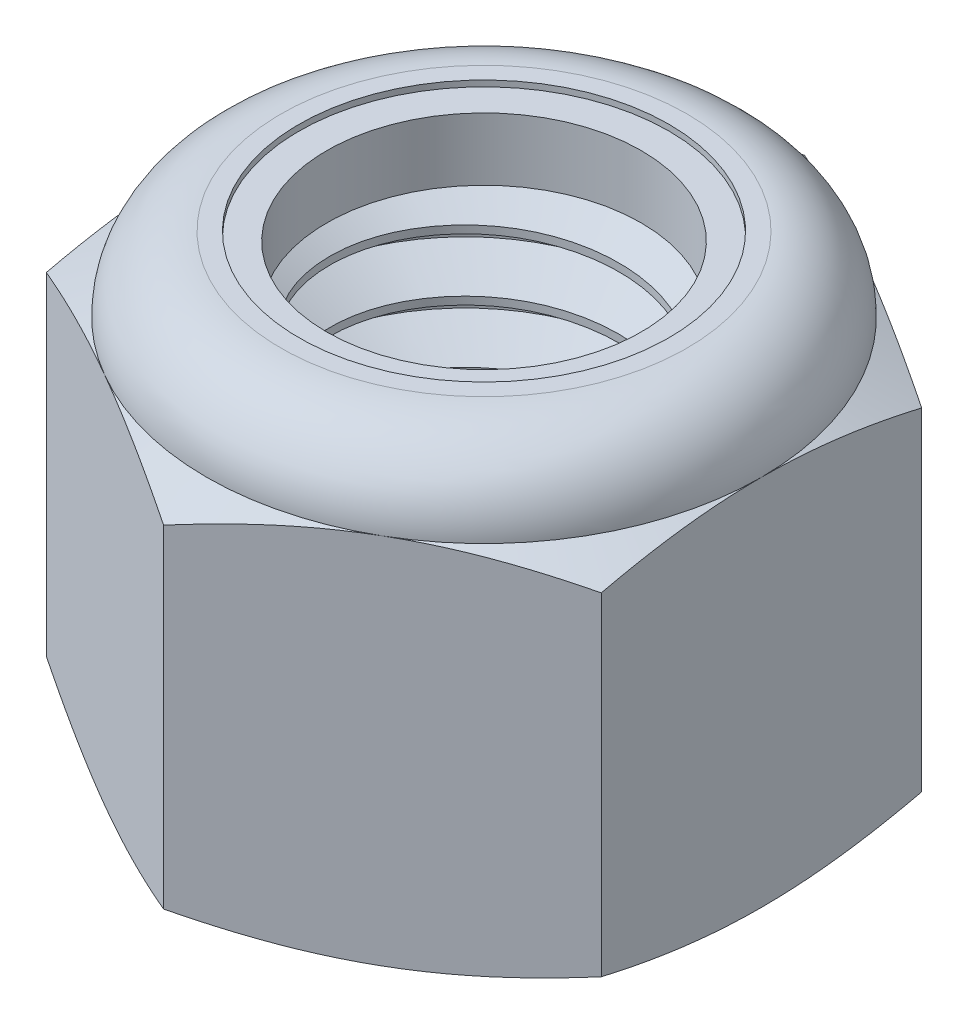
from build123d import *

# Parameters (mm, degrees)
SKETCH13_R       = 4.7625
EXTRUDE1_DEPTH   = 11.509375
SKETCH2_W        = 4.7625
SKETCH2_H        = 9.591145833
CUT_SWEEP1_PITCH = 1.5875
SKETCH12_W       = 5.23875
SKETCH12_H       = 9.591145833


with BuildPart() as part:
    # Sketch13 → Extrude1 (new body)
    with BuildSketch(Plane(origin=(0, 0, 0), x_dir=(1, 0, 0), z_dir=(0, 1, 0))):
        Polygon((0, 8.248891971), (-7.14375, 4.124445986), (-7.14375, -4.124445986), (0, -8.248891971), (7.14375, -4.124445986), (7.14375, 4.124445986), align=None)
        with Locations(Location((0, 0, 0), (0, 0, 90))):
            Circle(SKETCH13_R, mode=Mode.SUBTRACT)
    extrude(amount=EXTRUDE1_DEPTH)

    # Sketch5 → Cut-Revolve3 (revolve, cut)
    with BuildSketch(Plane(origin=(0, 0, 0), x_dir=(0, 0, -1), z_dir=(1, 0, 0))):
        with BuildLine():
            Line((0, 0), (7.14375, 0))
            Line((7.14375, 0), (8.248891971, 0.515336164))
            Line((8.248891971, 0.515336164), (8.248891971, 9.075809669))
            Line((8.248891971, 9.075809669), (7.14375, 9.591145833))
            ThreePointArc((7.14375, 9.591145833), (6.581913685, 10.947538685), (5.225520833, 11.509375))
            Line((5.225520833, 11.509375), (5.225520833, 12.779375))
            Line((5.225520833, 12.779375), (9.518891971, 12.779375))
            Line((9.518891971, 12.779375), (9.518891971, -1.27))
            Line((9.518891971, -1.27), (0, -1.27))
            Line((0, -1.27), (0, 0))
        make_face()
    revolve(axis=Axis((0, 0, 0), (0, 1, 0)), mode=Mode.SUBTRACT)

    # Sketch6 → Cut-Revolve4 (revolve, cut)
    with BuildSketch(Plane(origin=(0, 0, 0), x_dir=(0, 0, -1), z_dir=(1, 0, 0))):
        with BuildLine():
            Line((0, 9.591145833), (6.99135, 9.591145833))
            ThreePointArc((6.99135, 9.591145833), (6.474150612, 10.839775612), (5.225520833, 11.356975))
            Line((5.225520833, 11.356975), (2.612760417, 11.356975))
            Line((2.612760417, 11.356975), (2.612760417, 12.779375))
            Line((2.612760417, 12.779375), (0, 12.779375))
            Line((0, 12.779375), (0, 9.591145833))
        make_face()
    revolve(axis=Axis((0, 12.779375, 0), (0, -1, 0)), mode=Mode.SUBTRACT)

    # Sketch4 → Cut-Revolve2 (revolve, cut)
    with BuildSketch(Plane(origin=(0, 0, 0), x_dir=(0, 0, -1), z_dir=(1, 0, 0))):
        Polygon((0, 9.591145833), (5.23875, 9.591145833), (0, 7.148276589), align=None)
        Polygon((0, 2.442869244), (5.23875, 0), (0, 0), align=None)
    revolve(axis=Axis((0, 0, 0), (0, 1, 0)), mode=Mode.SUBTRACT)

    # Sketch12 → Revolve4 (revolve)
    with BuildSketch(Plane(origin=(0, 0, 0), x_dir=(0, 0, -1), z_dir=(1, 0, 0)), mode=Mode.PRIVATE) as revolve4_sk:
        with Locations((2.619375, 4.795572917)):
            Rectangle(SKETCH12_W, SKETCH12_H)
    revolve(revolve4_sk.sketch.rotate(Axis((0, 0, 0), (0, 1, 0)), 180), axis=Axis((0, 0, 0), (0, 1, 0)))


with BuildPart() as body_2:
    # Sketch7 → Revolve2 (revolve)
    with BuildSketch(Plane(origin=(0, 0, 0), x_dir=(0, 0, -1), z_dir=(1, 0, 0))):
        with BuildLine():
            Line((4.048125, 9.667345833), (6.913430867, 9.667345833))
            ThreePointArc((6.913430867, 9.667345833), (6.39301751, 10.812537757), (5.225520833, 11.280775))
            Line((5.225520833, 11.280775), (4.048125, 11.280775))
            Line((4.048125, 11.280775), (4.048125, 9.667345833))
        make_face()
    revolve(axis=Axis((0, 9.667345833, 0), (0, 1, 0)))


with BuildPart() as body_3:
    # Sketch2 → Revolve1 (revolve)
    with BuildSketch(Plane(origin=(0, 0, 0), x_dir=(0, 0, -1), z_dir=(1, 0, 0)), mode=Mode.PRIVATE) as revolve1_sk:
        with Locations((2.38125, 4.795572917)):
            Rectangle(SKETCH2_W, SKETCH2_H)
    revolve(revolve1_sk.sketch.rotate(Axis((0, -4.7625, 0), (0, 1, 0)), 180), axis=Axis((0, -4.7625, 0), (0, 1, 0)))

    # Cut-Sweep1: the profile of Sketch9 screwed along a right-hand helix of 8.25 turns, 8 arcs to a turn; built about Z, then put on its axis
    cut_sweep1_z = Axis((0, 0, 0), (0, 0, 1))
    cut_sweep1_corners = [(4.934351916, 0, 0.09921875), (4.848425958, 0, -1.438671875), (3.731388504, 0, -0.79375), (3.731388504, 0, -0.5953125)]
    with BuildLine(mode=Mode.PRIVATE) as cut_sweep1_profile:
        Line(cut_sweep1_corners[0], cut_sweep1_corners[1])
        Line(cut_sweep1_corners[1], cut_sweep1_corners[2])
        Line(cut_sweep1_corners[2], cut_sweep1_corners[3])
        Line(cut_sweep1_corners[3], cut_sweep1_corners[0])
    cut_sweep1_cap = Face(cut_sweep1_profile.wire())
    cut_sweep1_turn_angles = [0, 22.5, 45, 67.5, 90, 112.5, 135, 157.5, 180, 202.5, 225, 247.5, 270, 292.5, 315, 337.5, 360]
    cut_sweep1_turn_weights = [1, 0.9238795325112867, 1, 0.9238795325112867, 1, 0.9238795325112867, 1, 0.9238795325112867, 1, 0.9238795325112867, 1, 0.9238795325112867, 1, 0.9238795325112867, 1, 0.9238795325112867, 1]
    cut_sweep1_turn_rails = [Edge.make_bspline([Vector(p[0], p[1], 0).rotate(cut_sweep1_z, cut_sweep1_turn_angles[k]) / cut_sweep1_turn_weights[k] + Vector(0, 0, p[2] + CUT_SWEEP1_PITCH * cut_sweep1_turn_angles[k] / 360) for k in range(17)], [0, 0, 0, 1, 1, 2, 2, 3, 3, 4, 4, 5, 5, 6, 6, 7, 7, 8, 8, 8], 2, cut_sweep1_turn_weights) for p in cut_sweep1_corners]
    cut_sweep1_turn_sides = [Face.make_surface_from_curves(cut_sweep1_turn_rails[p[0]], cut_sweep1_turn_rails[p[1]]) for p in [(0, 1), (1, 2), (2, 3), (3, 0)]]
    cut_sweep1_last_angles = [2880, 2902.5, 2925, 2947.5, 2970]
    cut_sweep1_last_weights = [1, 0.9238795325112867, 1, 0.9238795325112185, 1]
    cut_sweep1_last_rails = [Edge.make_bspline([Vector(p[0], p[1], 0).rotate(cut_sweep1_z, cut_sweep1_last_angles[k]) / cut_sweep1_last_weights[k] + Vector(0, 0, p[2] + CUT_SWEEP1_PITCH * cut_sweep1_last_angles[k] / 360) for k in range(5)], [0, 0, 0, 1, 1, 2, 2, 2], 2, cut_sweep1_last_weights) for p in cut_sweep1_corners]
    cut_sweep1_last_sides = [Face.make_surface_from_curves(cut_sweep1_last_rails[p[0]], cut_sweep1_last_rails[p[1]]) for p in [(0, 1), (1, 2), (2, 3), (3, 0)]]
    cut_sweep1 = Plane(origin=(0, 9.591145833, 0), x_dir=(0, 0, -1), z_dir=(0, -1, 0)) * Solid(Shell([*[p.moved(Location((0, 0, CUT_SWEEP1_PITCH * i))) for i in range(8) for p in cut_sweep1_turn_sides], *cut_sweep1_last_sides, cut_sweep1_cap, cut_sweep1_cap.rotate(cut_sweep1_z, 2970).moved(Location((0, 0, CUT_SWEEP1_PITCH * 2970 / 360)))]))
    add(cut_sweep1, mode=Mode.SUBTRACT)

    # Sketch11 → Revolve3 (revolve)
    with BuildSketch(Plane(origin=(0, 0, 0), x_dir=(0, 0, -1), z_dir=(1, 0, 0)), mode=Mode.PRIVATE) as revolve3_sk:
        Polygon((0, 0), (5.23875, 0), (0, 2.442869244), align=None)
    revolve(revolve3_sk.sketch.rotate(Axis((0, 11.509375, 0), (0, -1, 0)), 350.377460032), axis=Axis((0, 11.509375, 0), (0, -1, 0)))


with BuildPart() as part_1:
    add(part.part)

    # Combine1: cut body 3
    add(body_3.part, mode=Mode.SUBTRACT)


solid = Compound([body_2.part, part_1.part])
